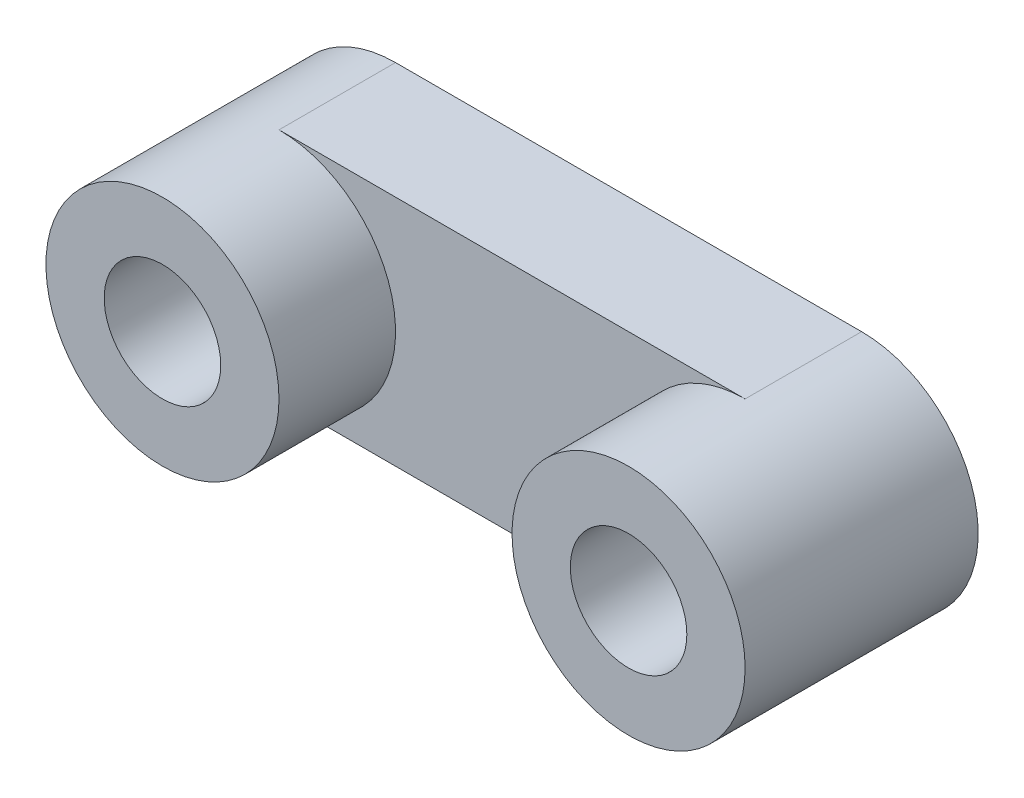
from build123d import *

# Parameters (mm, degrees)
ESTRUSIONE_ESTRUSIONE1_DEPTH = 5
SCHIZZO2_R                   = 5
SCHIZZO2_R_2                 = 2.5
ESTRUSIONE_ESTRUSIONE2_DEPTH = 5


with BuildPart() as part:
    # Schizzo1 → Estrusione-Estrusione1 (new body)
    with BuildSketch(Plane.XY):
        with BuildLine():
            Line((-7.862204724, 5), (12.137795276, 5))
            ThreePointArc((12.137795276, 5), (17.137795276, 0), (12.137795276, -5))
            Line((12.137795276, -5), (-7.862204724, -5))
            ThreePointArc((-7.862204724, -5), (-12.862204724, 0), (-7.862204724, 5))
        make_face()
    extrude(amount=ESTRUSIONE_ESTRUSIONE1_DEPTH)

    # Schizzo2 → Estrusione-Estrusione2 (add)
    # profile 1 of 2: a face of its own
    with BuildSketch(Plane.XY.offset(5)):
        with Locations((-7.862204724, 0)):
            Circle(SCHIZZO2_R)
        with Locations((-7.862204724, 0)):
            Circle(SCHIZZO2_R_2, mode=Mode.SUBTRACT)
    # profile 2 of 2: a face of its own
    with BuildSketch(Plane.XY.offset(5)):
        with Locations((12.137795276, 0)):
            Circle(SCHIZZO2_R)
        with Locations((12.137795276, 0)):
            Circle(SCHIZZO2_R_2, mode=Mode.SUBTRACT)
    extrude(amount=ESTRUSIONE_ESTRUSIONE2_DEPTH)


solid = part.part
